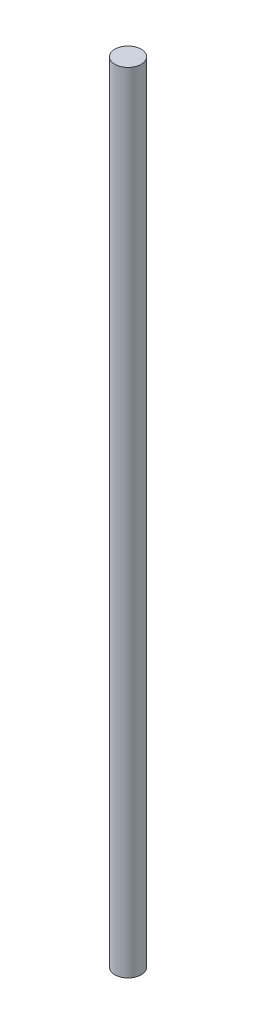
from build123d import *

# Parameters (mm, degrees)
ESQUISSE1_R        = 1.5
BOSS_EXTRU_1_DEPTH = 90


with BuildPart() as part:
    # Esquisse1 → Boss.-Extru.1 (new body)
    with BuildSketch(Plane(origin=(0, 0, 0), x_dir=(1, 0, 0), z_dir=(0, 1, 0))):
        Circle(ESQUISSE1_R)
    extrude(amount=BOSS_EXTRU_1_DEPTH)


solid = part.part
